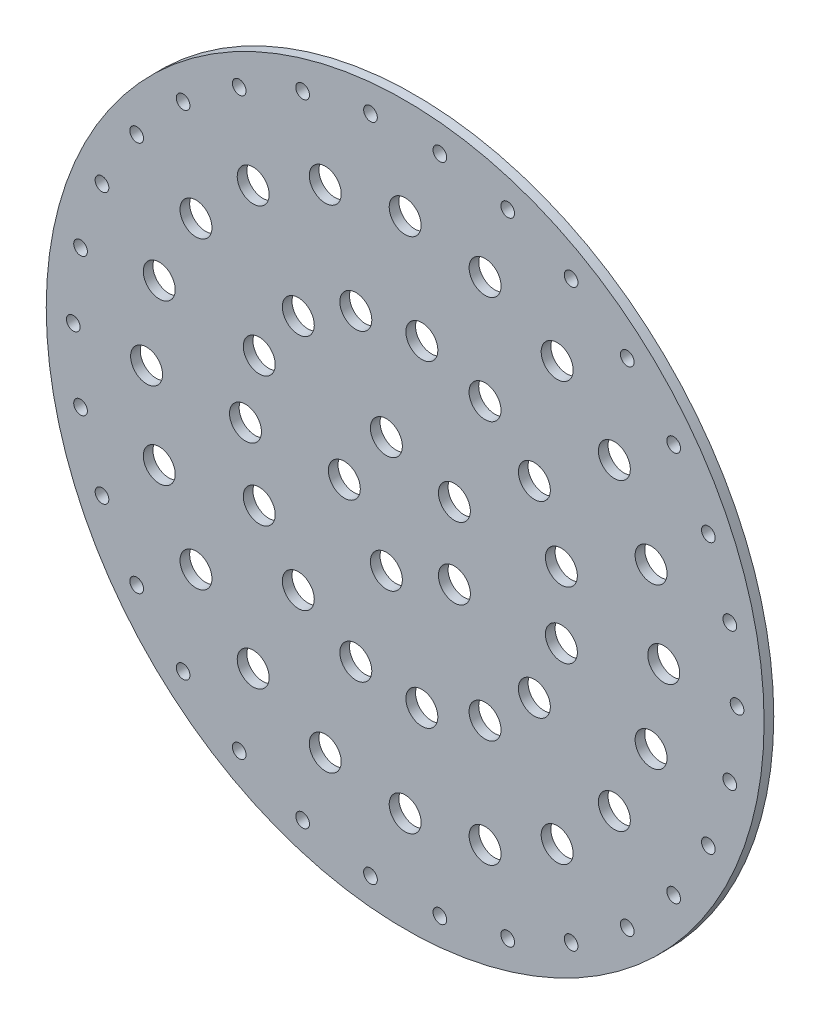
from build123d import *

# Parameters (mm, degrees)
SKETCH1_R           = 2.2479
BOSS_EXTRUDE1_DEPTH = 3.175
SKETCH5_3_R         = 5.25
CUT_EXTRUDE2_DEPTH  = 10
CIRPATTERN1_COUNT   = 5
SKETCH5_5_R         = 5.25
CUT_EXTRUDE4_DEPTH  = 167.907401349
CIRPATTERN3_COUNT   = 15
SKETCH5_6_R         = 5.25
CUT_EXTRUDE5_DEPTH  = 10
CIRPATTERN4_COUNT   = 20


with BuildPart() as part:
    # Sketch1 → Boss-Extrude1 (new body)
    with BuildSketch(Plane.XY):
        with BuildLine():
            ThreePointArc((115.886477974, -22.233403312), (0, 118), (-115.886477974, -22.233403312))
            ThreePointArc((-115.886477974, -22.233403312), (0, -118), (115.886477974, -22.233403312))
        make_face()
        with Locations((109.1, 0)):
            Circle(SKETCH1_R, mode=Mode.SUBTRACT)
        with Locations((106.71590324, -22.683165468)):
            Circle(SKETCH1_R, mode=Mode.SUBTRACT)
        with Locations((99.667809429, -44.37496776)):
            Circle(SKETCH1_R, mode=Mode.SUBTRACT)
        with Locations((88.263754086, -64.127371025)):
            Circle(SKETCH1_R, mode=Mode.SUBTRACT)
        with Locations((73.002149154, -81.07710046)):
            Circle(SKETCH1_R, mode=Mode.SUBTRACT)
        with Locations((54.55, -94.483371553)):
            Circle(SKETCH1_R, mode=Mode.SUBTRACT)
        with Locations((33.713754086, -103.760265928)):
            Circle(SKETCH1_R, mode=Mode.SUBTRACT)
        with Locations((11.404055343, -108.502338785)):
            Circle(SKETCH1_R, mode=Mode.SUBTRACT)
        with Locations((-11.404055343, -108.502338785)):
            Circle(SKETCH1_R, mode=Mode.SUBTRACT)
        with Locations((-33.713754086, -103.760265928)):
            Circle(SKETCH1_R, mode=Mode.SUBTRACT)
        with Locations((-54.55, -94.483371553)):
            Circle(SKETCH1_R, mode=Mode.SUBTRACT)
        with Locations((-73.002149154, -81.07710046)):
            Circle(SKETCH1_R, mode=Mode.SUBTRACT)
        with Locations((-88.263754086, -64.127371025)):
            Circle(SKETCH1_R, mode=Mode.SUBTRACT)
        with Locations((-99.667809429, -44.37496776)):
            Circle(SKETCH1_R, mode=Mode.SUBTRACT)
        with Locations((-106.71590324, -22.683165468)):
            Circle(SKETCH1_R, mode=Mode.SUBTRACT)
        with Locations((-109.1, 0)):
            Circle(SKETCH1_R, mode=Mode.SUBTRACT)
        with Locations((-106.71590324, 22.683165468)):
            Circle(SKETCH1_R, mode=Mode.SUBTRACT)
        with Locations((-99.667809429, 44.37496776)):
            Circle(SKETCH1_R, mode=Mode.SUBTRACT)
        with Locations((-88.263754086, 64.127371025)):
            Circle(SKETCH1_R, mode=Mode.SUBTRACT)
        with Locations((-73.002149154, 81.07710046)):
            Circle(SKETCH1_R, mode=Mode.SUBTRACT)
        with Locations((-54.55, 94.483371553)):
            Circle(SKETCH1_R, mode=Mode.SUBTRACT)
        with Locations((-33.713754086, 103.760265928)):
            Circle(SKETCH1_R, mode=Mode.SUBTRACT)
        with Locations((-11.404055343, 108.502338785)):
            Circle(SKETCH1_R, mode=Mode.SUBTRACT)
        with Locations((11.404055343, 108.502338785)):
            Circle(SKETCH1_R, mode=Mode.SUBTRACT)
        with Locations((33.713754086, 103.760265928)):
            Circle(SKETCH1_R, mode=Mode.SUBTRACT)
        with Locations((54.55, 94.483371553)):
            Circle(SKETCH1_R, mode=Mode.SUBTRACT)
        with Locations((73.002149154, 81.07710046)):
            Circle(SKETCH1_R, mode=Mode.SUBTRACT)
        with Locations((88.263754086, 64.127371025)):
            Circle(SKETCH1_R, mode=Mode.SUBTRACT)
        with Locations((99.667809429, 44.37496776)):
            Circle(SKETCH1_R, mode=Mode.SUBTRACT)
        with Locations((106.71590324, 22.683165468)):
            Circle(SKETCH1_R, mode=Mode.SUBTRACT)
    extrude(amount=BOSS_EXTRUDE1_DEPTH)

    # Sketch5<3> → Cut-Extrude2 (cut)
    with BuildSketch(Plane(origin=(0, 0, 0), x_dir=(-1, 0, 0), z_dir=(0, 0, -1))):
        with Locations((20, 0)):
            Circle(SKETCH5_3_R)
    cut_extrude2 = extrude(amount=-CUT_EXTRUDE2_DEPTH, mode=Mode.SUBTRACT)

    # CirPattern1: Cut-Extrude2 ×5 about axis
    cirpattern1_axis = Axis((0, 0, 0), (0, 0, 1))
    for i in range(1, CIRPATTERN1_COUNT):
        add(cut_extrude2.rotate(cirpattern1_axis, i * 360 / CIRPATTERN1_COUNT), mode=Mode.SUBTRACT)

    # Sketch5<5> → Cut-Extrude4 (cut, through all)
    with BuildSketch(Plane(origin=(0, 0, 0), x_dir=(-1, 0, 0), z_dir=(0, 0, -1))):
        with Locations((52.5, 0)):
            Circle(SKETCH5_5_R)
    cut_extrude4 = extrude(amount=-CUT_EXTRUDE4_DEPTH, mode=Mode.SUBTRACT)

    # CirPattern3: Cut-Extrude4 ×15 about axis
    cirpattern3_axis = Axis((0, 0, 0), (0, 0, 1))
    for i in range(1, CIRPATTERN3_COUNT):
        add(cut_extrude4.rotate(cirpattern3_axis, i * 360 / CIRPATTERN3_COUNT), mode=Mode.SUBTRACT)

    # Sketch5<6> → Cut-Extrude5 (cut)
    with BuildSketch(Plane(origin=(0, 0, 0), x_dir=(-1, 0, 0), z_dir=(0, 0, -1))):
        with Locations((85, 0)):
            Circle(SKETCH5_6_R)
    cut_extrude5 = extrude(amount=-CUT_EXTRUDE5_DEPTH, mode=Mode.SUBTRACT)

    # CirPattern4: Cut-Extrude5 ×20 about axis
    cirpattern4_axis = Axis((0, 0, 0), (0, 0, 1))
    for i in range(1, CIRPATTERN4_COUNT):
        add(cut_extrude5.rotate(cirpattern4_axis, i * 360 / CIRPATTERN4_COUNT), mode=Mode.SUBTRACT)


solid = part.part
